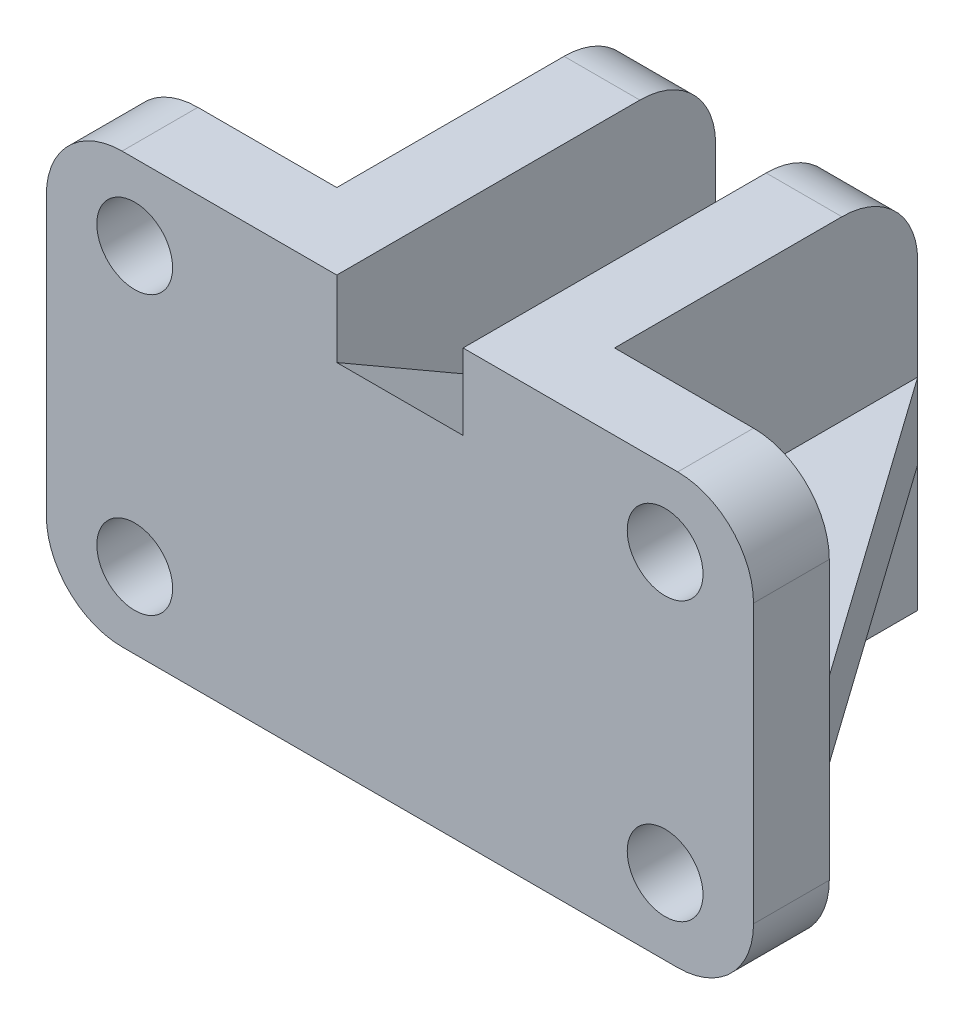
from build123d import *

# Parameters (mm, degrees)
SKETCH_1_W          = 28
SKETCH_1_H          = 17
EXTRUDE_1_DEPTH     = 3
EXTRUDE_2_DEPTH     = 5.5
CUT_EXTRUDE_1_DEPTH = 2.5
RIB_4_REACH         = 22.304
SKETCH_5_WALL_W     = 57.313322178
SKETCH_5_WALL_H     = 3
FILLET_1_R          = 3
SKETCH_6_R          = 1.5
CUT_EXTRUDE_2_DEPTH = 5.3
EXTRUDE_3_DEPTH     = 5.5
CUT_EXTRUDE_3_DEPTH = 2.5
FILLET_3_R          = 3
FILLET_4_R          = 10


with BuildPart() as part:
    # 草图1 → 凸台-拉伸1 (new body)
    with BuildSketch(Plane.XY):
        Rectangle(SKETCH_1_W, SKETCH_1_H)
    extrude(amount=EXTRUDE_1_DEPTH)

    # 草图3 → 凸台-拉伸2 (add, symmetric)
    with BuildSketch(Plane(origin=(0, 0, 0), x_dir=(0, 0, -1), z_dir=(1, 0, 0))):
        Polygon((0, 8.5), (12, 1.57179677), (12, -6.5), (0, -6.5), (0, 1.57179677), align=None)
    extrude(amount=EXTRUDE_2_DEPTH, both=True)

    # 草图4 → 切除-拉伸1 (cut, symmetric)
    with BuildSketch(Plane(origin=(0, 0, 0), x_dir=(0, 0, -1), z_dir=(1, 0, 0))):
        Polygon((0, 8.5), (12, 1.57179677), (12, -3.160254038), (0, 3.767949192), (-3, 5.5), (-3, 10.232050808), align=None)
    extrude(amount=CUT_EXTRUDE_1_DEPTH, both=True, mode=Mode.SUBTRACT)

    # 草图5 wall → 筋4 (add, up to next)
    with BuildSketch(Plane(origin=(9.75, 0, -6), x_dir=(0.57801734078, 0, 0.816024481102), z_dir=(0.816024481102, 0, -0.57801734078)), mode=Mode.PRIVATE) as rib_4_sk1:
        Rectangle(SKETCH_5_WALL_W, SKETCH_5_WALL_H)
    rib_4_tool1 = extrude(rib_4_sk1.sketch, amount=-RIB_4_REACH, mode=Mode.PRIVATE) - part.part
    rib_4 = rib_4_tool1.solids().sort_by_distance((9.75, 0, -6))[0]
    add(rib_4)

    # 镜向1: 筋4 across plane
    add(rib_4.mirror(Plane(origin=(0, 0, 0), x_dir=(0, 0, 1), z_dir=(1, 0, 0))))

    # 圆角1
    fillet_1_edges = [part.edges().sort_by_distance(p)[0] for p in [
        (14, -8.5, 1.5),
        (-14, -8.5, 1.5),
        (-14, 8.5, 1.5),
        (14, 8.5, 1.5),
    ]]
    fillet(fillet_1_edges, radius=FILLET_1_R)

    # 草图6 → 切除-拉伸2 (cut)
    with BuildSketch(Plane(origin=(0, 0, 0), x_dir=(-1, 0, 0), z_dir=(0, 0, -1))):
        with Locations((-10.5, 5.5)):
            Circle(SKETCH_6_R)
        with Locations((10.5, 5.5)):
            Circle(SKETCH_6_R)
        with Locations((10.5, -5.5)):
            Circle(SKETCH_6_R)
        with Locations((-10.5, -5.5)):
            Circle(SKETCH_6_R)
    extrude(amount=-CUT_EXTRUDE_2_DEPTH, mode=Mode.SUBTRACT)

    # 草图7 → 凸台-拉伸3 (add, symmetric)
    with BuildSketch(Plane(origin=(0, 0, 0), x_dir=(0, 0, -1), z_dir=(1, 0, 0))):
        Polygon((0, 8.5), (12, 8.5), (12, 1.57179677), align=None)
    extrude(amount=EXTRUDE_3_DEPTH, both=True)

    # 草图7<2> → 切除-拉伸3 (cut, symmetric)
    with BuildSketch(Plane(origin=(0, 0, 0), x_dir=(0, 0, -1), z_dir=(1, 0, 0))):
        Polygon((0, 8.5), (12, 8.5), (12, 1.57179677), align=None)
    extrude(amount=CUT_EXTRUDE_3_DEPTH, both=True, mode=Mode.SUBTRACT)

    # 圆角3
    fillet_3_edges = [part.edges().sort_by_distance(p)[0] for p in [
        (4, 8.5, -12),
        (-4, 8.5, -12),
    ]]
    fillet(fillet_3_edges, radius=FILLET_3_R)

    # 圆角4
    # the kernel refuses this fillet: 10 mm, written as the material it takes off along each edge
    with BuildSketch(Plane(origin=(2.5, -3.160254038, -12), x_dir=(0, -1, 0), z_dir=(-1, 0, 0))) as fillet_4_piece_1:
        with BuildLine():
            CenterArc((FILLET_4_R * 0.57735026919, FILLET_4_R), FILLET_4_R, 210, 60)
            Line((-FILLET_4_R * 0.288675134595, FILLET_4_R * 0.5), (0, 0))
            Line((0, 0), (FILLET_4_R * 0.57735026919, 0))
        make_face()
    extrude(amount=5, mode=Mode.SUBTRACT)


solid = part.part
